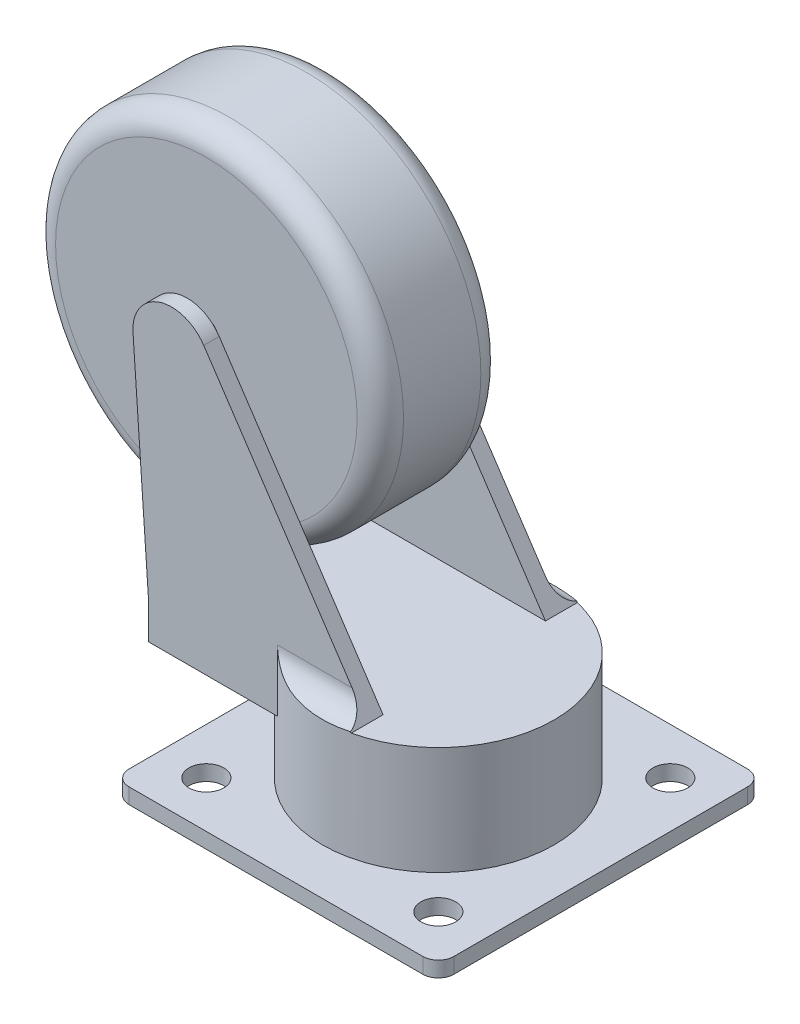
from build123d import *
from build123d.topology import SkipClean

# Parameters (mm, degrees)
SKETCH1_R                = 2.25
BOSS_EXTRUDE1_DEPTH      = 2
SKETCH2_R                = 15
BOSS_EXTRUDE2_DEPTH      = 9
BOSS_EXTRUDE3_DEPTH      = 5
SKETCH4_R                = 1.5
BOSS_EXTRUDE4_DEPTH      = 2
FILLET1_R                = 3
BOSS_EXTRUDE5_DEPTH      = 8
BOSS_EXTRUDE5_DEPTH_BACK = 8
SKETCH5_R                = 22.5
FILLET2_R                = 3
SKETCH6_R                = 1.5
BOSS_EXTRUDE6_DEPTH      = 25


with BuildPart() as part:
    # Sketch1 → Boss-Extrude1 (new body)
    with BuildSketch(Plane(origin=(0, 0, 0), x_dir=(1, 0, 0), z_dir=(0, 1, 0))):
        with BuildLine():
            Line((-19, 21), (19, 21))
            ThreePointArc((19, 21), (20.414213562, 20.414213562), (21, 19))
            Line((21, 19), (21, -19))
            ThreePointArc((21, -19), (20.414213562, -20.414213562), (19, -21))
            Line((19, -21), (-19, -21))
            ThreePointArc((-19, -21), (-20.414213562, -20.414213562), (-21, -19))
            Line((-21, -19), (-21, 19))
            ThreePointArc((-21, 19), (-20.414213562, 20.414213562), (-19, 21))
        make_face()
        with Locations(Location((-15, 15, 0), (0, 0, 270))):
            Circle(SKETCH1_R, mode=Mode.SUBTRACT)
        with Locations(Location((15, 15, 0), (0, 0, 90))):
            Circle(SKETCH1_R, mode=Mode.SUBTRACT)
        with Locations(Location((15, -15, 0), (0, 0, 270))):
            Circle(SKETCH1_R, mode=Mode.SUBTRACT)
        with Locations(Location((-15, -15, 0), (0, 0, 90))):
            Circle(SKETCH1_R, mode=Mode.SUBTRACT)
    extrude(amount=BOSS_EXTRUDE1_DEPTH)

    # Sketch2 → Boss-Extrude2 (add)
    with BuildSketch(Plane(origin=(0, 2, 0), x_dir=(1, 0, 0), z_dir=(0, 1, 0))):
        with Locations(Location((0, 0, 0), (0, 0, 270))):
            Circle(SKETCH2_R)
    extrude(amount=BOSS_EXTRUDE2_DEPTH)

    # Sketch3 → Boss-Extrude3 (add)
    with SkipClean():  # the faces are left unmerged after this step: merging them gives an invalid solid
        with BuildSketch(Plane(origin=(0, 11, 0), x_dir=(1, 0, 0), z_dir=(0, 1, 0))):
            with BuildLine():
                Line((-25, 12.5), (-8.291561976, 12.5))
                ThreePointArc((-8.291561976, 12.5), (15, 0), (-8.291561976, -12.5))
                Line((-8.291561976, -12.5), (-25, -12.5))
                Line((-25, -12.5), (-25, 12.5))
            make_face()
        extrude(amount=BOSS_EXTRUDE3_DEPTH)

    # Sketch4 → Boss-Extrude4 (add)
    with SkipClean():  # the faces are left unmerged after this step: merging them gives an invalid solid
        with BuildSketch(Plane.XY.offset(12.5)):
            with BuildLine():
                Line((-25, 16), (-26.988009316, 44.653931998))
                ThreePointArc((-26.988009316, 44.653931998), (-23.614360312, 49.732213096), (-17.840451563, 47.774555244))
                Line((-17.840451563, 47.774555244), (3.354219012, 16))
                Line((3.354219012, 16), (-25, 16))
            make_face()
            with Locations((-22, 45)):
                Circle(SKETCH4_R, mode=Mode.SUBTRACT)
        boss_extrude4 = extrude(amount=-BOSS_EXTRUDE4_DEPTH)

    # Mirror1: Boss-Extrude4 across plane
    with SkipClean():  # the faces are left unmerged after this step: merging them gives an invalid solid
        add(boss_extrude4.mirror(Plane.XY))

    # Fillet1
    # the kernel refuses this fillet: 3 mm, written as the material it adds along each edge
    with BuildSketch(Plane(origin=(10.854219012, 16, 12.5), x_dir=(0, 0, 1), z_dir=(-1, 0, 0))) as fillet1_piece_1_section:
        with BuildLine():
            CenterArc((FILLET1_R, FILLET1_R), FILLET1_R, 180, 90)
            Line((0, FILLET1_R), (0, 0))
            Line((0, 0), (FILLET1_R, 0))
        make_face()
    fillet1_piece_1 = extrude(amount=26.645780988, mode=Mode.PRIVATE)
    fillet1_piece_1 = fillet1_piece_1 & Plane(origin=(0, 16.711249506, 0), x_dir=(-0.5527707983925666, 0, -0.8333333333333335), z_dir=(0, -1, 0)) * Cylinder(15, 66, mode=Mode.PRIVATE)
    fillet1_piece_1 = split(fillet1_piece_1, bisect_by=Plane(origin=(1.321328689, 19.047661706, 13.078964715), z_dir=(-0.8319096874112317, -0.5549110487198348, 0)), keep=Keep.TOP, mode=Mode.PRIVATE)
    add(fillet1_piece_1)
    with BuildSketch(Plane(origin=(10.854219012, 16, -12.5), x_dir=(0, 0, -1), z_dir=(-1, 0, 0))) as fillet1_piece_2_section:
        with BuildLine():
            CenterArc((FILLET1_R, -FILLET1_R), FILLET1_R, 90, 90)
            Line((0, -FILLET1_R), (0, 0))
            Line((0, 0), (FILLET1_R, 0))
        make_face()
    fillet1_piece_2 = extrude(amount=26.645780988, mode=Mode.PRIVATE)
    fillet1_piece_2 = fillet1_piece_2 & Plane(origin=(0, 16.711251501, 0), x_dir=(-0.5527707983925666, 0, -0.8333333333333335), z_dir=(0, -1, 0)) * Cylinder(15, 66, mode=Mode.PRIVATE)
    fillet1_piece_2 = split(fillet1_piece_2, bisect_by=Plane(origin=(1.321327042, 19.047664174, -13.078969709), z_dir=(-0.8319096874112317, -0.5549110487198348, 0)), keep=Keep.TOP, mode=Mode.PRIVATE)
    add(fillet1_piece_2)



with BuildPart() as body_2:
    # Sketch5 → Boss-Extrude5 (new, two sides: drawn at the far end of the back side and taken through both)
    with BuildSketch(Plane.XY.offset(-BOSS_EXTRUDE5_DEPTH_BACK)):
        with Locations((-22, 45)):
            Circle(SKETCH5_R)
    extrude(amount=BOSS_EXTRUDE5_DEPTH + BOSS_EXTRUDE5_DEPTH_BACK)

    # Fillet2
    fillet2_edges = [body_2.edges().sort_by_distance(p)[0] for p in [
        (-44.5, 45, 8),
        (-44.5, 45, -8),
    ]]
    fillet(fillet2_edges, radius=FILLET2_R)


with BuildPart() as part_1:
    add(part.part)

    add(body_2.part)  # Boss-Extrude6 merges body 2
    # Sketch6 → Boss-Extrude6 (add)
    with BuildSketch(Plane.XY.offset(12.5)):
        with Locations((-22, 45)):
            Circle(SKETCH6_R)
    extrude(amount=-BOSS_EXTRUDE6_DEPTH)


solid = part_1.part
